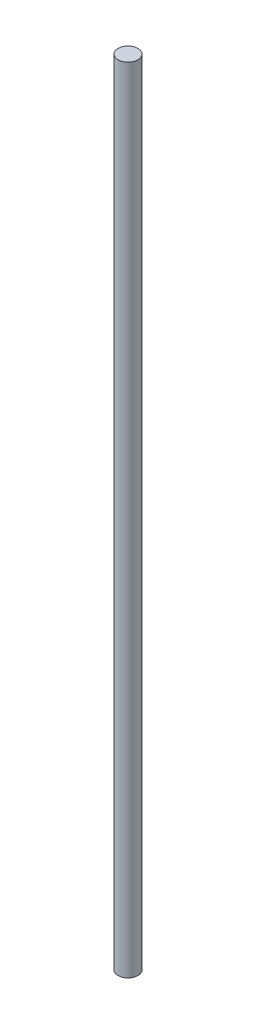
from build123d import *

# Parameters (mm, degrees)
SKETCH2_R           = 5
BOSS_EXTRUDE1_DEPTH = 400


with BuildPart() as part:
    # Sketch2 → Boss-Extrude1 (new body)
    with BuildSketch(Plane(origin=(0, 0, 0), x_dir=(1, 0, 0), z_dir=(0, 1, 0))):
        Circle(SKETCH2_R)
    extrude(amount=BOSS_EXTRUDE1_DEPTH)


solid = part.part
